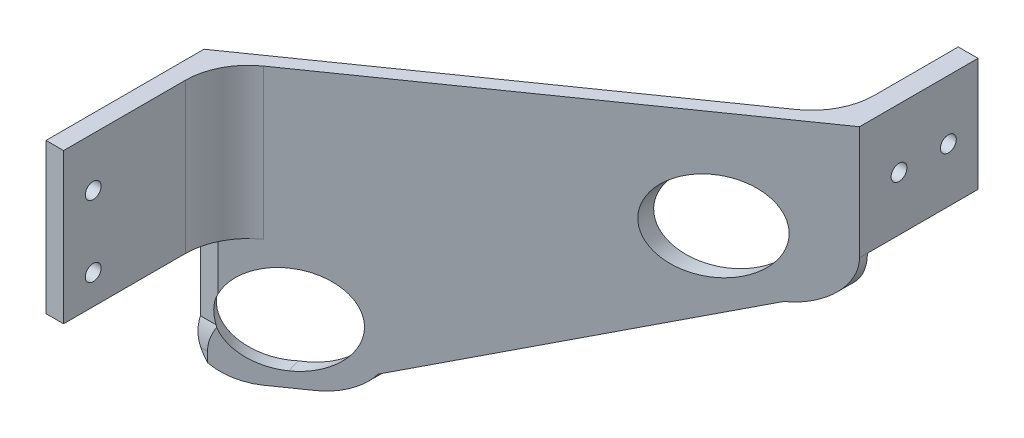
from build123d import *

# Parameters (mm, degrees)
SKETCH1_R                = 14.312899999999999
BOSS_EXTRUDE1_DEPTH      = 6.35
FILLET1_R                = 14.2875
SKETCH2_W                = 63.5
SKETCH2_H                = 38.099999999999994
BOSS_EXTRUDE2_DEPTH      = 6.35
FILLET2_R                = 14.2875
SKETCH5_W                = 80.56082205671558
SKETCH5_H                = 59.96207335790194
CUT_EXTRUDE3_DEPTH       = 105.34114720473416
SKETCH6_R                = 14.312899999999999
BOSS_EXTRUDE3_DEPTH      = 88.89999999999999
CHAMFER1_SIZE            = 123.334861862
CHAMFER1_SIZE_2          = 86.36
CHAMFER2_START           = -41.62371919
CHAMFER2_OUTLINE_W       = 158.00000000000003
CHAMFER2_OUTLINE_H       = 88.9
CHAMFER2_DEPTH           = 70.741970545
BOSS_EXTRUDE4_DEPTH      = 6.35
BOSS_EXTRUDE5_DEPTH      = 73.65999999999998
CUT_EXTRUDE9_DEPTH       = 140.7047508401556
CUT_EXTRUDE9_DEPTH_BACK  = 140.7047508401556
CUT_EXTRUDE10_DEPTH      = 73.65999999999998
CUT_EXTRUDE10_DEPTH_BACK = 184.87947802715968
FILLET3_R                = 20.16
SKETCH19_R               = 2.539999999999996
CUT_EXTRUDE11_DEPTH      = 184.87947795602068
SKETCH20_R               = 2.5400000000000027
SKETCH20_R_2             = 2.540000000000001
CUT_EXTRUDE12_DEPTH      = 188.65942191717963
FILLET4_R                = 20.16
CUT_EXTRUDE13_DEPTH      = 330.8952367610784
CUT_EXTRUDE13_DEPTH_BACK = 330.8952367610784
SKETCH21_W               = 304.0212933781311
SKETCH21_H               = 127.80861110845143


with BuildPart() as part:
    # Sketch1 → Boss-Extrude1 (new body)
    with BuildSketch(Plane.XY):
        Polygon((-6.34999999999998, -6.349999999999993), (63.500000000000014, -6.349999999999988), (63.50000000000003, 44.44999999999999), (-63.49999999999997, 44.44999999999999), (-63.49999999999994, -44.45), (-31.749999999999943, -44.45), align=None)
        with Locations((-44.44999999999997, -25.400000000000006)):
            Circle(SKETCH1_R, mode=Mode.SUBTRACT)
        with Locations((35.87185256827684, 12.70000000000001)):
            Circle(SKETCH1_R, mode=Mode.SUBTRACT)
    extrude(amount=BOSS_EXTRUDE1_DEPTH)

    # Fillet1
    fillet1_edges = [part.edges().sort_by_distance(p)[0] for p in [
        (-31.749999999999943, -44.45, 3.175),
        (-63.49999999999994, -44.45, 3.175),
        (63.50000000000002, -6.349999999999987, 3.175),
        (-6.349999999999981, -6.349999999999993, 3.175),
    ]]
    fillet(fillet1_edges, radius=FILLET1_R)

    # Sketch2 → Boss-Extrude2 (add)
    with BuildSketch(Plane.XY.offset(6.35)):
        with Locations((2.842e-14, 63.499999999999986)):
            Rectangle(SKETCH2_W, SKETCH2_H)
    extrude(amount=-BOSS_EXTRUDE2_DEPTH)

    # Fillet2
    fillet2_edges = [part.edges().sort_by_distance(p)[0] for p in [
        (-31.74999999999997, 82.54999999999998, 3.175),
        (31.75000000000003, 82.54999999999998, 3.175),
        (31.75000000000003, 44.44999999999999, 3.175),
    ]]
    fillet(fillet2_edges, radius=FILLET2_R)

    # Sketch5 → Cut-Extrude3 (cut, through all)
    with BuildSketch(Plane.XY.offset(6.35)):
        with Locations((8.530411028357818, 74.43103667895096)):
            Rectangle(SKETCH5_W, SKETCH5_H)
    extrude(amount=-CUT_EXTRUDE3_DEPTH, mode=Mode.SUBTRACT)

    # Sketch6 → Boss-Extrude3 (add)
    # profile 1 of 2: a face of its own
    with BuildSketch(Plane.XY.offset(6.35)):
        with BuildLine():
            Line((-27.50851936904525, -38.08777905356794), (49.21250000000003, -6.349999999999989))
            Line((49.21250000000003, -6.349999999999989), (1.296437949397273, -6.3499999999999925))
            ThreePointArc((1.296437949397273, -6.3499999999999925), (-5.445232161641531, -8.040574170103001), (-10.591480630954672, -12.71222094643204))
            Line((-10.591480630954672, -12.71222094643204), (-27.50851936904525, -38.08777905356794))
        make_face()
    # profile 2 of 2: a face of its own
    with BuildSketch(Plane.XY.offset(6.35)):
        with BuildLine():
            ThreePointArc((49.21250000000003, -6.349999999999989), (59.315288136202824, -2.1652881362027863), (63.50000000000003, 7.937500000000011))
            Line((63.50000000000003, 7.937500000000011), (63.50000000000003, 44.44999999999999))
            Line((63.50000000000003, 44.44999999999999), (-63.49999999999997, 44.44999999999999))
            Line((-63.49999999999997, 44.44999999999999), (-63.49999999999994, -30.162500000000005))
            ThreePointArc((-63.49999999999994, -30.162500000000005), (-59.31528813620274, -40.2652881362028), (-49.21249999999995, -44.45))
            Line((-49.21249999999995, -44.45), (-39.396437949397196, -44.45))
            ThreePointArc((-39.396437949397196, -44.45), (-32.65476783835839, -42.759425829897), (-27.50851936904525, -38.08777905356794))
            Line((-27.50851936904525, -38.08777905356794), (-10.591480630954672, -12.71222094643204))
            ThreePointArc((-10.591480630954672, -12.71222094643204), (-5.445232161641531, -8.040574170103001), (1.296437949397273, -6.3499999999999925))
            Line((1.296437949397273, -6.3499999999999925), (49.21250000000003, -6.349999999999989))
        make_face()
        with Locations((35.87185256827684, 12.70000000000001)):
            Circle(SKETCH6_R, mode=Mode.SUBTRACT)
        with Locations((-44.44999999999997, -25.400000000000006)):
            Circle(SKETCH6_R, mode=Mode.SUBTRACT)
    extrude(amount=-BOSS_EXTRUDE3_DEPTH)

    # Chamfer1
    # the kernel refuses this chamfer: 123.334861862, 86.36 mm, written as the material it takes off along each edge
    with BuildSketch(Plane(origin=(63.50000000000003, -310.58122257411287, -82.55), x_dir=(-1, 0, 0), z_dir=(0, 1, 0))) as chamfer1_piece_1:
        Polygon((CHAMFER1_SIZE, 0), (0, CHAMFER1_SIZE_2), (0, 0), align=None)
    extrude(amount=673.5499451482258, mode=Mode.SUBTRACT)

    # Chamfer2: read off the stored shape, not the designer's step
    # Chamfer2 outline → Chamfer2 (cut)
    with BuildSketch(Plane(origin=(0, 0, 0), x_dir=(0.819152044288991, 0, 0.5735764363510472), z_dir=(0.5735764363510472, 0, -0.8191520442889911)).offset(CHAMFER2_START)):
        with Locations((-22.000000000000004, 0)):
            Rectangle(CHAMFER2_OUTLINE_W, CHAMFER2_OUTLINE_H)
    extrude(amount=CHAMFER2_DEPTH, mode=Mode.SUBTRACT)

    # Sketch8 → Boss-Extrude4 (add)
    with BuildSketch(Plane(origin=(63.50000000000003, 0, 0), x_dir=(0, 0, -1), z_dir=(1, 0, 0))):
        Polygon((-3.8100000000002296, 44.44999999999999), (-41.91000000000023, 44.44999999999998), (-41.910000000000224, 7.937500000000005), (-3.8100000000002257, 7.937500000000011), align=None)
    extrude(amount=-BOSS_EXTRUDE4_DEPTH)

    # Sketch10 → Boss-Extrude5 (add)
    with BuildSketch(Plane(origin=(0, 44.44999999999999, 0), x_dir=(1, 0, 0), z_dir=(0, 1, 0))):
        Polygon((-57.84497848897024, 130.81000000000014), (-63.49999999999997, 130.81000000000014), (-63.49999999999997, 80.01000000000018), (-57.844978488970234, 80.01000000000016), align=None)
    extrude(amount=-BOSS_EXTRUDE5_DEPTH)

    # Sketch17 → Cut-Extrude9 (cut, two sides: drawn at the far end of the back side and taken through both)
    with BuildSketch(Plane(origin=(19.10074600681286, 0, -27.278692336917096), x_dir=(-0.8191520442889909, 0, -0.5735764363510474), z_dir=(0.5735764363510474, 0, -0.8191520442889909)).offset(-CUT_EXTRUDE9_DEPTH_BACK)):
        with BuildLine():
            add(Edge.make_bspline(
                [(94.42353448054058, -29.21), (95.93788750756819, -24.718047698019056), (93.93338517829203, -20.356820676396385)],
                knots=[2.872150837356143, 2.872150837356143, 2.872150837356143, 3.5016757767347815, 3.5016757767347815, 3.5016757767347815], degree=2, weights=[1, 0.9508699428937519, 1]))
            add(Edge.make_bspline(
                [(93.93338517829203, -20.356820676396385), (88.79622683458668, -9.179825042266891), (74.45226902252679, -11.318450120374129), (60.108311210466894, -13.457075198481366), (60.108311210466894, -25.4)],
                knots=[3.5016757767347815, 3.5016757767347815, 3.5016757767347815, 4.892430541957184, 4.892430541957184, 6.283185307179586, 6.283185307179586, 6.283185307179586], degree=2, weights=[1, 0.7678119767762641, 1, 0.7678119767762641, 1]))
            add(Edge.make_bspline(
                [(60.108311210466894, -25.400000000000002), (60.108311210466894, -37.903779229296156), (75.2342951684929, -39.58320874739981), (90.36027912651893, -41.262638265503455), (94.42353448054058, -29.21)],
                knots=[0, 0, 0, 1.4360754186780715, 1.4360754186780715, 2.872150837356143, 2.872150837356143, 2.872150837356143], degree=2, weights=[1, 0.7530981852489751, 1, 0.7530981852489751, 1]))
        make_face()
    extrude(amount=CUT_EXTRUDE9_DEPTH + CUT_EXTRUDE9_DEPTH_BACK, mode=Mode.SUBTRACT)

    # Sketch18 → Cut-Extrude10 (cut, two sides: drawn at the far end of the back side and taken through both)
    with BuildSketch(Plane(origin=(-57.84497848897023, 0, 7.9e-15), x_dir=(-1.4e-16, 0, -1), z_dir=(1, 0, -1.4e-16)).offset(-CUT_EXTRUDE10_DEPTH_BACK)):
        Polygon((130.81000000000014, -29.21), (81.15666866187213, -29.210000000000008), (81.15666866187213, -3.8100000000000076), (130.81000000000014, -3.810000000000001), align=None)
    extrude(amount=CUT_EXTRUDE10_DEPTH + CUT_EXTRUDE10_DEPTH_BACK, mode=Mode.SUBTRACT)

    # Fillet3
    # the kernel refuses this fillet: 20.16 mm, written as the material it adds along each edge
    with BuildSketch(Plane(origin=(57.150000000000034, 44.44999999999999, 4.470039485332174), x_dir=(-0.8191520442889912, 0, -0.5735764363510469), z_dir=(0, -1, 0))) as fillet3_piece_1_section:
        with BuildLine():
            CenterArc((FILLET3_R * 0.520567050552, -FILLET3_R), FILLET3_R, 90.00000000000001, 54.99999999999993)
            Line((-FILLET3_R * 0.298584993737, -FILLET3_R * 0.426423563649), (0, 0))
            Line((0, 0), (FILLET3_R * 0.520567050552, 0))
        make_face()
    fillet3_piece_1 = extrude(amount=36.51249999999998, mode=Mode.PRIVATE)
    fillet3_piece_1 = fillet3_piece_1 - Plane(origin=(35.87185256827684, 12.70000000000001, 4.470039485332174), x_dir=(1, 0, 0), z_dir=(0, 0, 1)) * Cylinder(14.312899999999999, 116, mode=Mode.PRIVATE)
    add(fillet3_piece_1)
    with BuildSketch(Plane(origin=(-57.844978488970234, 44.44999999999999, -81.15666866204359), x_dir=(0.8191520442884476, 0, 0.5735764363518233), z_dir=(0, -1, 0))) as fillet3_piece_2:
        with BuildLine():
            CenterArc((FILLET3_R * 0.520567050551, -FILLET3_R), FILLET3_R, 90.00000000000001, 54.99999999994567)
            Line((-FILLET3_R * 0.298584993737, -FILLET3_R * 0.426423563648), (0, 0))
            Line((0, 0), (FILLET3_R * 0.520567050551, 0))
        make_face()
    extrude(amount=48.25999999999999)

    # Sketch19 → Cut-Extrude11 (cut, through all)
    with BuildSketch(Plane(origin=(-57.84497848897023, 0, 7.9e-15), x_dir=(-1.4e-16, 0, -1), z_dir=(1, 0, -1.4e-16))):
        with Locations((121.28500000000014, 28.57499999999999)):
            Circle(SKETCH19_R)
        with Locations((121.28500000000014, 5.7149999999999945)):
            Circle(SKETCH19_R)
    extrude(amount=-CUT_EXTRUDE11_DEPTH, mode=Mode.SUBTRACT)

    # Sketch20 → Cut-Extrude12 (cut, through all)
    with BuildSketch(Plane(origin=(63.50000000000003, 0, 0), x_dir=(0, 0, -1), z_dir=(1, 0, 0))):
        with Locations((-32.38500000000023, 25.39999999999998)):
            Circle(SKETCH20_R)
        with Locations((-16.510000000000232, 25.399999999999977)):
            Circle(SKETCH20_R_2)
    extrude(amount=-CUT_EXTRUDE12_DEPTH, mode=Mode.SUBTRACT)

    # Fillet4
    # the kernel refuses this fillet: 20.16 mm, written as the material it takes off along each edge
    with BuildSketch(Plane(origin=(-41.42329156376277, -29.209999999999994, -82.55), x_dir=(0, -2.04e-14, 1), z_dir=(-1, 0, 0))) as fillet4_piece_1:
        with BuildLine():
            CenterArc((20.160000000000146, -7.364628119294481), FILLET4_R, 158.57340370727903, 21.426596292722138)
            Line((1.5023e-13, -7.364628119294892), (-0.403199999999848, -7.3646281192949))
            Line((-0.403199999999848, -7.3646281192949), (-0.4031999999999982, -8.22e-15))
            Line((-0.4031999999999982, -8.22e-15), (-8.22e-15, 0.4031999999999982))
            ThreePointArc((-8.22e-15, 0.4031999999999982), (0.6966656690639528, 0.4031999999999982), (1.0179979648904802, 0.14729256238588861))
            Line((1.0179979648904802, 0.14729256238588861), (1.393331338127922, 0))
        make_face()
    extrude(amount=40.48827873447443, mode=Mode.SUBTRACT)

    # Mirror1: part across plane


with BuildPart() as part_1:
    add(part.part)
    add(part.part.mirror(Plane(origin=(-57.84497848897024, -29.21, -130.81000000000014), x_dir=(1, 0, 0), z_dir=(0, 0, -1))))

    # Sketch21 → Cut-Extrude13 (cut, two sides: drawn at the far end of the back side and taken through both)
    with BuildSketch(Plane(origin=(-57.84497848897023, 0, 7.9e-15), x_dir=(-1.4e-16, 0, -1), z_dir=(1, 0, -1.4e-16)).offset(-CUT_EXTRUDE13_DEPTH_BACK)):
        with Locations((-21.20064668906538, -19.454305554225726)):
            Rectangle(SKETCH21_W, SKETCH21_H)
    extrude(amount=CUT_EXTRUDE13_DEPTH + CUT_EXTRUDE13_DEPTH_BACK, mode=Mode.SUBTRACT)


solid = part_1.part
